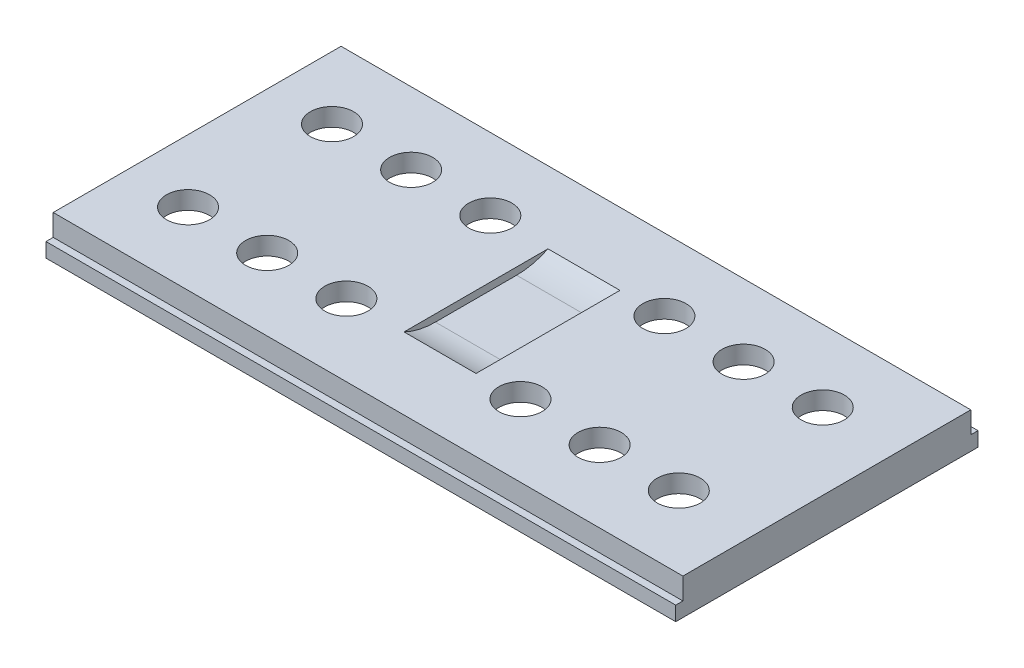
from build123d import *

# Parameters (mm, degrees)
SKETCH1_W           = 87.5
SKETCH1_H           = 42
BOSS_EXTRUDE1_DEPTH = 5
SKETCH2_W           = 87.5
SKETCH2_H           = 1
CUT_EXTRUDE1_DEPTH  = 3
SKETCH3_W           = 87.5
SKETCH3_H           = 1
CUT_EXTRUDE2_DEPTH  = 3
SKETCH4_W           = 10
SKETCH4_H           = 20
CUT_EXTRUDE3_DEPTH  = 1
FILLET1_R           = 10
FILLET2_R           = 10
SHELL6_START        = -41.25
SHELL6_DEPTH        = 82.5
SHELL6_2_DEPTH      = 33.75
SHELL6_START_2      = 7.5
SHELL6_3_DEPTH      = 33.75
SKETCH5_R           = 3
CUT_EXTRUDE4_DEPTH  = 2.5
LPATTERN1_COUNT     = 3
LPATTERN1_PITCH     = 11


# Read off the part's stored shape, not the designer's step: Shell6
with BuildPart() as part:
    # Sketch1 → Boss-Extrude1 (new body)
    with BuildSketch(Plane(origin=(0, 0, 0), x_dir=(1, 0, 0), z_dir=(0, 1, 0))):
        Rectangle(SKETCH1_W, SKETCH1_H)
    extrude(amount=BOSS_EXTRUDE1_DEPTH)

    # Sketch2 → Cut-Extrude1 (cut)
    with BuildSketch(Plane(origin=(0, 5, 0), x_dir=(1, 0, 0), z_dir=(0, 1, 0))):
        with Locations((0, 20.5)):
            Rectangle(SKETCH2_W, SKETCH2_H)
    extrude(amount=-CUT_EXTRUDE1_DEPTH, mode=Mode.SUBTRACT)

    # Sketch3 → Cut-Extrude2 (cut)
    with BuildSketch(Plane(origin=(0, 5, 0), x_dir=(1, 0, 0), z_dir=(0, 1, 0))):
        with Locations((0, -20.5)):
            Rectangle(SKETCH3_W, SKETCH3_H)
    extrude(amount=-CUT_EXTRUDE2_DEPTH, mode=Mode.SUBTRACT)

    # Sketch4 → Cut-Extrude3 (cut)
    with BuildSketch(Plane(origin=(0, 5, 0), x_dir=(1, 0, 0), z_dir=(0, 1, 0))):
        Rectangle(SKETCH4_W, SKETCH4_H)
    extrude(amount=-CUT_EXTRUDE3_DEPTH, mode=Mode.SUBTRACT)

    # Fillet1
    # the kernel refuses this fillet: 10 mm, written as the material it adds along each edge
    with BuildSketch(Plane(origin=(15.897247359, 4, 10), x_dir=(0, 1, 0), z_dir=(-1, 0, 0))) as fillet1_piece_1:
        with BuildLine():
            CenterArc((10, 4.358898944), FILLET1_R, 180, 25.841932763)
            Line((0, 4.358898944), (-0.2, 4.358898944))
            Line((-0.2, 4.358898944), (-0.2, 0))
            Line((-0.2, 0), (0, -0.2))
            ThreePointArc((0, -0.2), (0.5, -0.2), (0.82, -0.087177979))
            Line((0.82, -0.087177979), (1, 0))
        make_face()
    extrude(amount=31.794494718)

    # Fillet2
    # the kernel refuses this fillet: 10 mm, written as the material it adds along each edge
    with BuildSketch(Plane(origin=(-15.897247359, 4, -10), x_dir=(0, 0, 1), z_dir=(1, 0, 0))) as fillet2_piece_1:
        with BuildLine():
            CenterArc((4.358898944, -10), FILLET2_R, 90, 25.841932763)
            Line((0, -1), (-0.087177979, -0.82))
            ThreePointArc((-0.087177979, -0.82), (-0.2, -0.5), (-0.2, 0))
            Line((-0.2, 0), (0, 0.2))
            Line((0, 0.2), (4.358898944, 0.2))
            Line((4.358898944, 0.2), (4.358898944, 0))
        make_face()
    extrude(amount=31.794494718)

    # Shell6 outline → Shell6 (cut)
    with BuildSketch(Plane.YZ.offset(SHELL6_START)):
        with BuildLine():
            Line((0, -17.5), (2.5, -17.5))
            Line((2.5, -17.5), (2.5, -10.540080542))
            ThreePointArc((2.5, -10.540080542), (1.752551286, -8.141101056), (1.5, -5.641101056))
            Line((1.5, -5.641101056), (1.5, 5.641101056))
            ThreePointArc((1.5, 5.641101056), (1.752551286, 8.141101056), (2.5, 10.540080542))
            Line((2.5, 10.540080542), (2.5, 17.5))
            Line((2.5, 17.5), (0, 17.5))
            Line((0, 17.5), (0, -17.5))
        make_face()
    extrude(amount=SHELL6_DEPTH, mode=Mode.SUBTRACT)

    # Shell6 2 outline → Shell6 2 (cut)
    with BuildSketch(Plane.YZ.offset(SHELL6_START)):
        with BuildLine():
            ThreePointArc((1.5, -5.641101056), (1.752551286, -8.141101056), (2.5, -10.540080542))
            Line((2.5, -10.540080542), (2.5, 10.540080542))
            ThreePointArc((2.5, 10.540080542), (1.752551286, 8.141101056), (1.5, 5.641101056))
            Line((1.5, 5.641101056), (1.5, -5.641101056))
        make_face()
    extrude(amount=SHELL6_2_DEPTH, mode=Mode.SUBTRACT)

    # Shell6 3 outline → Shell6 3 (cut)
    with BuildSketch(Plane.YZ.offset(SHELL6_START_2)):
        with BuildLine():
            ThreePointArc((1.5, -5.641101056), (1.752551286, -8.141101056), (2.5, -10.540080542))
            Line((2.5, -10.540080542), (2.5, 10.540080542))
            ThreePointArc((2.5, 10.540080542), (1.752551286, 8.141101056), (1.5, 5.641101056))
            Line((1.5, 5.641101056), (1.5, -5.641101056))
        make_face()
    extrude(amount=SHELL6_3_DEPTH, mode=Mode.SUBTRACT)

    # Sketch5 → Cut-Extrude4 (cut)
    with BuildSketch(Plane(origin=(0, 5, 0), x_dir=(1, 0, 0), z_dir=(0, 1, 0))):
        with Locations(Location((-35.01329609, 10, 0), (0, 0, 270))):
            Circle(SKETCH5_R)
        with Locations(Location((-35.01329609, -10, 0), (0, 0, 270))):
            Circle(SKETCH5_R)
        with Locations(Location((11.17688744, 10, 0), (0, 0, 270))):
            Circle(SKETCH5_R)
        with Locations(Location((11.17688744, -10, 0), (0, 0, 270))):
            Circle(SKETCH5_R)
    cut_extrude4 = extrude(amount=-CUT_EXTRUDE4_DEPTH, mode=Mode.SUBTRACT)

    # LPattern1: Cut-Extrude4 ×3
    with Locations(*[(i * LPATTERN1_PITCH, 0, 0) for i in range(1, LPATTERN1_COUNT)]):
        add(cut_extrude4, mode=Mode.SUBTRACT)


solid = part.part
